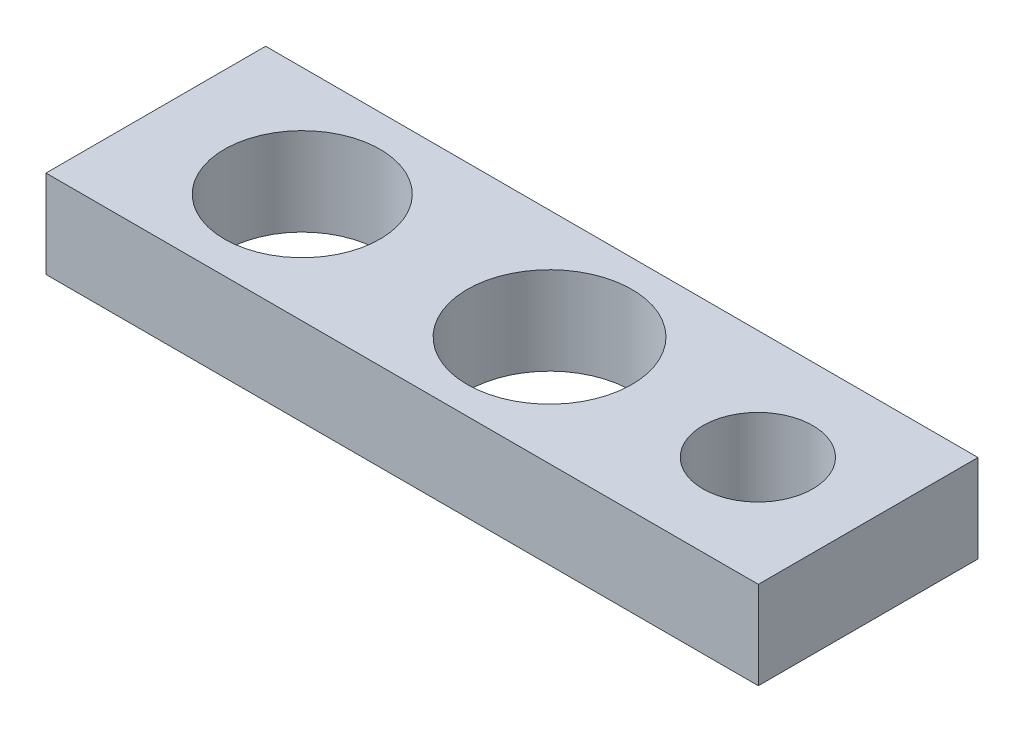
from build123d import *

# Parameters (mm, degrees)
SKETCH1_W           = 41.185763127
SKETCH1_H           = 12.7
SKETCH1_R           = 3.175
SKETCH1_R_2         = 4.7625
SKETCH1_R_3         = 4.5
BOSS_EXTRUDE1_DEPTH = 5.08


with BuildPart() as part:
    # Sketch1 → Boss-Extrude1 (new body)
    with BuildSketch(Plane(origin=(0, 0, 0), x_dir=(1, 0, 0), z_dir=(0, 1, 0))):
        with Locations((17.507118437, 6.35)):
            Rectangle(SKETCH1_W, SKETCH1_H)
        with Locations((31.722464109, 6.35)):
            Circle(SKETCH1_R, mode=Mode.SUBTRACT)
        with Locations((19.677866262, 6.35)):
            Circle(SKETCH1_R_2, mode=Mode.SUBTRACT)
        with Locations((5.379836225, 6.35)):
            Circle(SKETCH1_R_3, mode=Mode.SUBTRACT)
    extrude(amount=BOSS_EXTRUDE1_DEPTH)


solid = part.part
